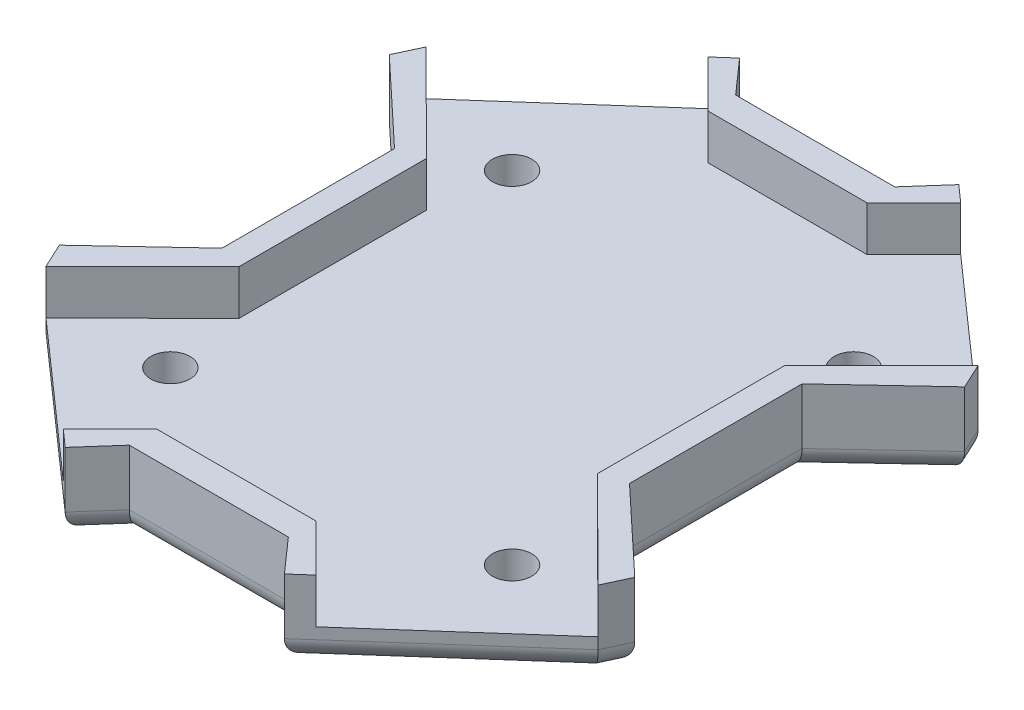
from build123d import *

# Parameters (mm, degrees)
SKETCH1_W           = 55
SKETCH1_H           = 64.43
BOSS_EXTRUDE1_DEPTH = 3
CUT_EXTRUDE1_DEPTH  = 4
SKETCH3_OUTSIDE_W   = 73.954
SKETCH3_OUTSIDE_H   = 83.384
CUT_EXTRUDE4_DEPTH  = 4
BOSS_EXTRUDE2_DEPTH = 3
BOSS_EXTRUDE3_DEPTH = 3
BOSS_EXTRUDE4_DEPTH = 4
BOSS_EXTRUDE5_DEPTH = 4
FILLET1_R           = 2
SKETCH9_R           = 1.75
CUT_EXTRUDE6_DEPTH  = 40.766745199


with BuildPart() as part:
    # Sketch1 → Boss-Extrude1 (new body)
    with BuildSketch(Plane(origin=(0, 0, 0), x_dir=(1, 0, 0), z_dir=(0, 1, 0))):
        Rectangle(SKETCH1_W, SKETCH1_H)
    extrude(amount=BOSS_EXTRUDE1_DEPTH)

    # Sketch2 → Cut-Extrude1 (cut)
    with BuildSketch(Plane(origin=(0, 3, 0), x_dir=(1, 0, 0), z_dir=(0, 1, 0))):
        Polygon((-27.5, -4.791277462), (-27.5, -14.373832386), (-17.5, -5), (-17.5, 5), (-27.5, 14.373832386), (-27.5, 4.791277462), align=None)
        Polygon((27.5, 4.791277462), (27.5, 14.373832386), (17.5, 5), (17.5, -5), (27.5, -14.373832386), (27.5, -4.791277462), align=None)
    extrude(amount=-CUT_EXTRUDE1_DEPTH, mode=Mode.SUBTRACT)

    # Sketch3 outside → Cut-Extrude4 (cut)
    with BuildSketch(Plane(origin=(0, 3, 0), x_dir=(1, 0, 0), z_dir=(0, 1, 0))):
        Rectangle(SKETCH3_OUTSIDE_W, SKETCH3_OUTSIDE_H)
        Polygon((-16, -5.649903378), (-16, 0), (-16, 5.649903378), (-25.681219861, 14.724916605), (-24.640371834, 16.957022404), (-9.782767538, 30.09765722), (-4.418267546, 24.032225889), (4.418267546, 24.032225889), (9.782767538, 30.09765722), (24.640371834, 16.957022404), (25.681219861, 14.724916605), (16, 5.649903378), (16, -5.649903378), (25.681219861, -14.724916605), (24.640371834, -16.957022404), (9.782767538, -30.09765722), (4.418267546, -24.032225889), (-4.418267546, -24.032225889), (-9.782767538, -30.09765722), (-24.640371834, -16.957022404), (-25.681219861, -14.724916605), align=None, mode=Mode.SUBTRACT)
    extrude(amount=-CUT_EXTRUDE4_DEPTH, mode=Mode.SUBTRACT)

    # Sketch4 → Boss-Extrude2 (add)
    with BuildSketch(Plane(origin=(0, 3, 0), x_dir=(1, 0, 0), z_dir=(0, 1, 0))):
        Polygon((-7.100517542, 27.064941555), (7.100517542, 27.064941555), (4.418267546, 24.032225889), (-4.418267546, 24.032225889), align=None)
        Polygon((-7.100517542, -27.064941555), (7.100517542, -27.064941555), (4.418267546, -24.032225889), (-4.418267546, -24.032225889), align=None)
    extrude(amount=-BOSS_EXTRUDE2_DEPTH)

    # Sketch5 → Boss-Extrude3 (add)
    with BuildSketch(Plane(origin=(0, 3, 0), x_dir=(1, 0, 0), z_dir=(0, 1, 0))):
        Polygon((-16, 5.649903378), (-18.188739123, 7.701590745), (-18.188739123, -7.701590745), (-16, -5.649903378), align=None)
        Polygon((16, 5.649903378), (18.188739123, 7.701590745), (18.188739123, -7.701590745), (16, -5.649903378), align=None)
    extrude(amount=-BOSS_EXTRUDE3_DEPTH)

    # Sketch6 → Boss-Extrude4 (add)
    with BuildSketch(Plane(origin=(0, 3, 0), x_dir=(1, 0, 0), z_dir=(0, 1, 0))):
        Polygon((-24.640371834, -16.957022404), (-25.681219861, -14.724916605), (-18.188739123, -7.701590745), (-18.188739123, 7.701590745), (-25.681219861, 14.724916605), (-24.640371834, 16.957022404), (-16, 8.373408054), (-16, -8.373408054), align=None)
        Polygon((16, -8.373408054), (24.640371834, -16.957022404), (25.681219861, -14.724916605), (18.188739123, -7.701590745), (18.188739123, 7.701590745), (25.681219861, 14.724916605), (24.640371834, 16.957022404), (16, 8.373408054), align=None)
    extrude(amount=BOSS_EXTRUDE4_DEPTH)

    # Sketch7 → Boss-Extrude5 (add)
    with BuildSketch(Plane(origin=(0, 3, 0), x_dir=(1, 0, 0), z_dir=(0, 1, 0))):
        Polygon((-1, 27.064941555), (-7.100517542, 27.064941555), (-9.782767538, 30.09765722), (-11.280892286, 28.772658262), (-7.100517542, 24.594941555), (-1, 24.594941555), (1, 24.594941555), (7.100517542, 24.594941555), (11.280892286, 28.772658262), (9.782767538, 30.09765722), (7.100517542, 27.064941555), (1, 27.064941555), align=None)
        Polygon((-1, -27.064941555), (-7.100517542, -27.064941555), (-9.782767538, -30.09765722), (-11.280892286, -28.772658262), (-7.100517542, -24.594941555), (-1, -24.594941555), (1, -24.594941555), (7.100517542, -24.594941555), (11.280892286, -28.772658262), (9.782767538, -30.09765722), (7.100517542, -27.064941555), (1, -27.064941555), align=None)
    extrude(amount=BOSS_EXTRUDE5_DEPTH)

    # Fillet1
    fillet1_edges = [part.edges().sort_by_distance(p)[0] for p in [
        (25.160795848, 0, -15.840969504),
        (21.934979492, 0, -11.213253675),
        (18.188739123, 0, 0),
        (21.934979492, 0, 11.213253675),
        (25.160795848, 0, 15.840969504),
        (17.211569686, 0, 23.527339812),
        (8.44164254, 0, 28.581299387),
        (0, 0, 27.064941555),
        (-8.44164254, 0, 28.581299387),
        (-17.211569686, 0, 23.527339812),
        (-25.160795848, 0, 15.840969504),
        (-21.934979492, 0, 11.213253675),
        (-18.188739123, 0, 0),
        (-25.160795848, 0, -15.840969504),
        (-21.934979492, 0, -11.213253675),
        (-17.211569686, 0, -23.527339812),
        (-8.44164254, 0, -28.581299387),
        (0, 0, -27.064941555),
        (8.44164254, 0, -28.581299387),
        (17.211569686, 0, -23.527339812),
    ]]
    fillet(fillet1_edges, radius=FILLET1_R)

    # Sketch9 → Cut-Extrude6 (cut, through all)
    with BuildSketch(Plane(origin=(0, 3, 0), x_dir=(1, 0, 0), z_dir=(0, 1, 0))):
        with Locations((15.251219861, -15.244152763)):
            Circle(SKETCH9_R)
        with Locations((15.251219861, 15.255847237)):
            Circle(SKETCH9_R)
        with Locations((-15.248780139, 15.255847237)):
            Circle(SKETCH9_R)
        with Locations((-15.248780139, -15.244152763)):
            Circle(SKETCH9_R)
    extrude(amount=-CUT_EXTRUDE6_DEPTH, mode=Mode.SUBTRACT)


solid = part.part
